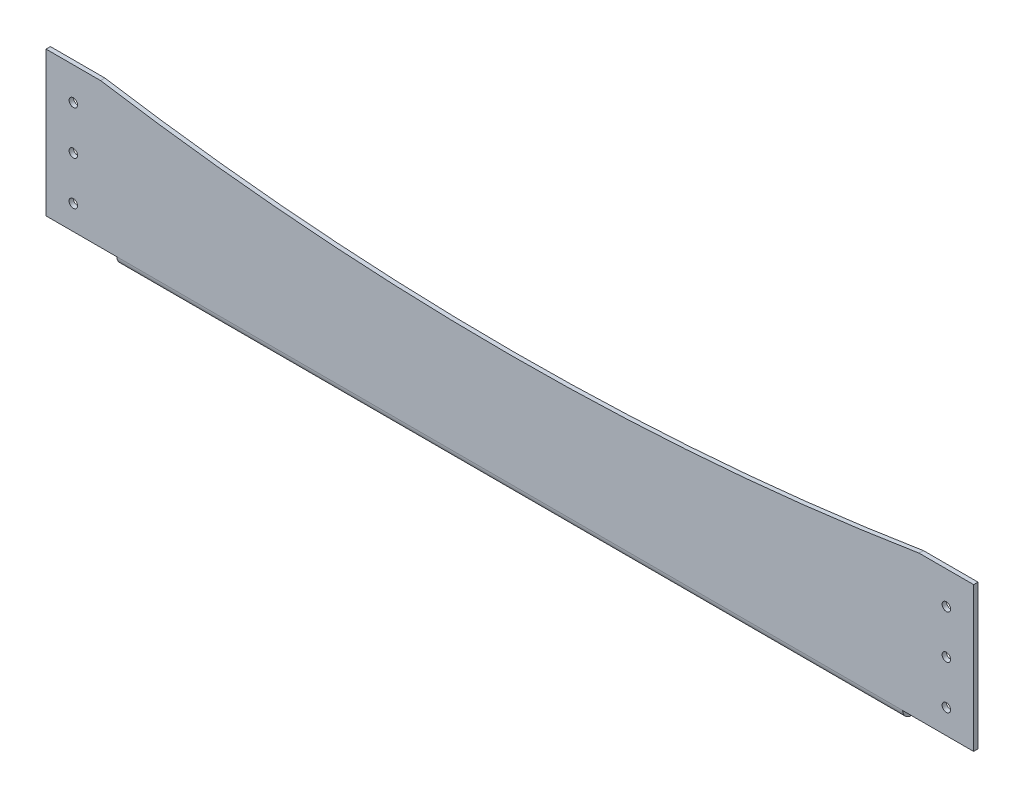
from build123d import *

# Parameters (mm, degrees)
SKETCH2_W             = 539.75
SKETCH2_H             = 84.069565479
BOSS_EXTRUDE1_DEPTH   = 2.54
EDGE_FLANGE1_DEPTH    = 457.2
CUT_EXTRUDE2_DEPTH    = 279.417450967
F_8_CLEARANCE_HOLE1_D = 4.9149


# Sheet-metal steps are written as plain solids
with BuildPart() as part:
    # Sketch2 → Boss-Extrude1 (new body)
    with BuildSketch(Plane.XY):
        with Locations((0, 21.465217261)):
            Rectangle(SKETCH2_W, SKETCH2_H)
    extrude(amount=BOSS_EXTRUDE1_DEPTH)

    # Edge-Flange1 section (across the edge) → Edge-Flange1 (add)
    with BuildSketch(Plane(origin=(228.6, -22.897046661, 0), x_dir=(0, 0.9961946980917445, -0.08715574274766974), z_dir=(-1, 0, 0))):
        with BuildLine():
            Line((-2.54, 2.327481182), (-2.54, 23.072518818))
            Line((-2.54, 23.072518818), (0, 23.072518818))
            Line((0, 23.072518818), (0, 2.327481182))
            ThreePointArc((0, 2.327481182), (0.667315565, 0.611482055), (2.318624413, -0.202853351))
            Line((2.318624413, -0.202853351), (2.097248827, -2.733187884))
            ThreePointArc((2.097248827, -2.733187884), (-1.205368871, -1.104517073), (-2.54, 2.327481182))
        make_face()
    extrude(amount=EDGE_FLANGE1_DEPTH)

    # Sketch17 → Cut-Extrude2 (cut, through all)
    with BuildSketch(Plane.XY.offset(2.54)):
        with BuildLine():
            Line((-238.125, 63.5), (238.125, 63.5))
            ThreePointArc((238.125, 63.5), (0, 44.45), (-238.125, 63.5))
        make_face()
    extrude(amount=-CUT_EXTRUDE2_DEPTH, mode=Mode.SUBTRACT)

    # #8 Clearance Hole1 (through all)
    with Locations(Plane.XY.offset(2.54)):
        with Locations((-254, 44.45), (-254, 19.05), (-254, -6.35), (254, -6.35), (254, 19.05), (254, 44.45)):
            Hole(F_8_CLEARANCE_HOLE1_D / 2)


solid = part.part
